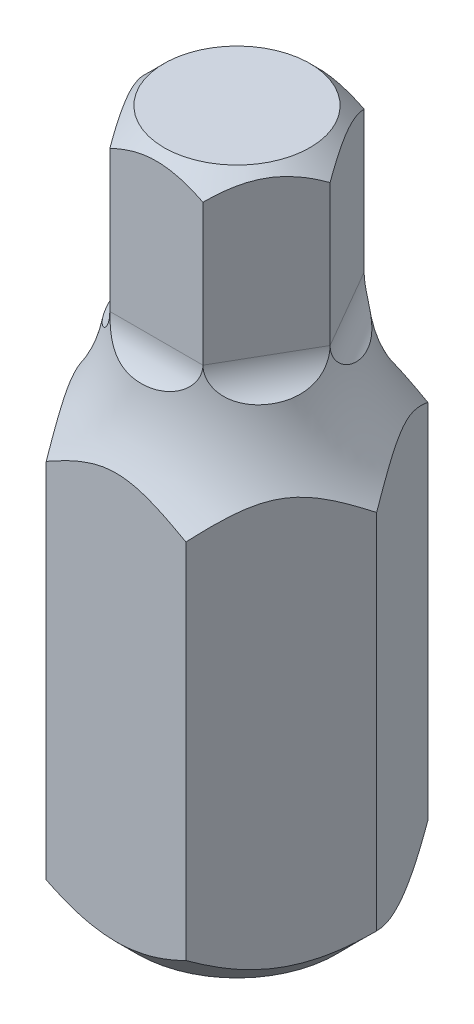
from build123d import *

# Parameters (mm, degrees)
SKETCH1_R           = 3
BOSS_EXTRUDE1_DEPTH = 12
BOSS_EXTRUDE2_START = 12
BOSS_EXTRUDE2_DEPTH = 5
FILLET1_R           = 1


with BuildPart() as part:
    # Sketch1 → Boss-Extrude1 (new body)
    # profile 1 of 8: a face of its own
    with BuildSketch(Plane(origin=(0, 0, 0), x_dir=(1, 0, 0), z_dir=(0, 1, 0))):
        with BuildLine():
            Line((1.732050808, 3), (0, 3))
            ThreePointArc((0, 3), (1.500000022, 2.598076199), (2.598076237, 1.499999956))
            Line((2.598076237, 1.499999956), (1.732050808, 3))
        make_face()
    # profile 2 of 8: a face of its own
    with BuildSketch(Plane(origin=(0, 0, 0), x_dir=(1, 0, 0), z_dir=(0, 1, 0))):
        Circle(SKETCH1_R)
        Polygon((1.154700538, -2), (-1.154700538, -2), (-2.309401077, 0), (-1.154700538, 2), (1.154700538, 2), (2.309401077, 0), align=None, mode=Mode.SUBTRACT)
    # profile 3 of 8: a face of its own
    with BuildSketch(Plane(origin=(0, 0, 0), x_dir=(1, 0, 0), z_dir=(0, 1, 0))):
        with BuildLine():
            Line((0, 3), (-1.732050808, 3))
            Line((-1.732050808, 3), (-2.598076237, 1.499999956))
            ThreePointArc((-2.598076237, 1.499999956), (-1.500000022, 2.598076199), (0, 3))
        make_face()
    # profile 4 of 8: a face of its own
    with BuildSketch(Plane(origin=(0, 0, 0), x_dir=(1, 0, 0), z_dir=(0, 1, 0))):
        with BuildLine():
            ThreePointArc((-2.598076237, -1.499999956), (-3, 0), (-2.598076237, 1.499999956))
            Line((-2.598076237, 1.499999956), (-3.464101615, 0))
            Line((-3.464101615, 0), (-2.598076237, -1.499999956))
        make_face()
    # profile 5 of 8: a face of its own
    with BuildSketch(Plane(origin=(0, 0, 0), x_dir=(1, 0, 0), z_dir=(0, 1, 0))):
        with BuildLine():
            ThreePointArc((0, -3), (-1.500000022, -2.598076199), (-2.598076237, -1.499999956))
            Line((-2.598076237, -1.499999956), (-1.732050808, -3))
            Line((-1.732050808, -3), (0, -3))
        make_face()
    # profile 6 of 8: a face of its own
    with BuildSketch(Plane(origin=(0, 0, 0), x_dir=(1, 0, 0), z_dir=(0, 1, 0))):
        with BuildLine():
            ThreePointArc((2.598076237, -1.499999956), (1.500000022, -2.598076199), (0, -3))
            Line((0, -3), (1.732050808, -3))
            Line((1.732050808, -3), (2.598076237, -1.499999956))
        make_face()
    # profile 7 of 8: a face of its own
    with BuildSketch(Plane(origin=(0, 0, 0), x_dir=(1, 0, 0), z_dir=(0, 1, 0))):
        with BuildLine():
            Line((3.464101615, 0), (2.598076237, 1.499999956))
            ThreePointArc((2.598076237, 1.499999956), (2.897777485, 0.776457111), (3, 0))
            ThreePointArc((3, 0), (2.897777485, -0.776457111), (2.598076237, -1.499999956))
            Line((2.598076237, -1.499999956), (3.464101615, 0))
        make_face()
    # profile 8 of 8: a face of its own
    with BuildSketch(Plane(origin=(0, 0, 0), x_dir=(1, 0, 0), z_dir=(0, 1, 0))):
        Polygon((-1.154700538, -2), (-2.309401077, 0), (-1.154700538, 2), (1.154700538, 2), (2.309401077, 0), (1.154700538, -2), align=None)
    extrude(amount=BOSS_EXTRUDE1_DEPTH)

    # Sketch1<3> → Boss-Extrude2 (add)
    with BuildSketch(Plane(origin=(0, 0, 0), x_dir=(1, 0, 0), z_dir=(0, 1, 0)).offset(BOSS_EXTRUDE2_START)):
        Polygon((-1.154700538, -2), (-2.309401077, 0), (-1.154700538, 2), (1.154700538, 2), (2.309401077, 0), (1.154700538, -2), align=None)
    extrude(amount=BOSS_EXTRUDE2_DEPTH)

    # Fillet1
    fillet1_edges = [part.edges().sort_by_distance(p)[0] for p in [
        (-1.732050808, 12, 1),
        (0, 12, 2),
        (1.732050808, 12, 1),
        (1.732050808, 12, -1),
        (0, 12, -2),
        (-1.732050808, 12, -1),
    ]]
    fillet(fillet1_edges, radius=FILLET1_R - 0.0001)  # a hair under: the kernel refuses the full size

    # Sketch2 → Cut-Revolve2 (revolve, cut)
    with BuildSketch(Plane(origin=(0, 0, 0), x_dir=(0.500000000000001, 0, 0.8660254037844382), z_dir=(-0.866025403784438, 0, 0.5000000000000009)), mode=Mode.PRIVATE) as cut_revolve2_sk:
        with BuildLine():
            Line((-2.309401077, 13), (-4, 13))
            Line((-4, 13), (-4, 9.484709743))
            ThreePointArc((-4, 9.484709743), (-2.75401547, 11.049654498), (-2.309401077, 13))
        make_face()
        Polygon((-4, 0), (-4, 1.535898385), (-2.464101615, 0), align=None)
        Polygon((-1.809401077, 17), (-4, 14.809401077), (-4, 17), align=None)
    revolve(cut_revolve2_sk.sketch.rotate(Axis((0, 17, 0), (0, -1, 0)), 239.999997716), axis=Axis((0, 17, 0), (0, -1, 0)), mode=Mode.SUBTRACT)


solid = part.part
